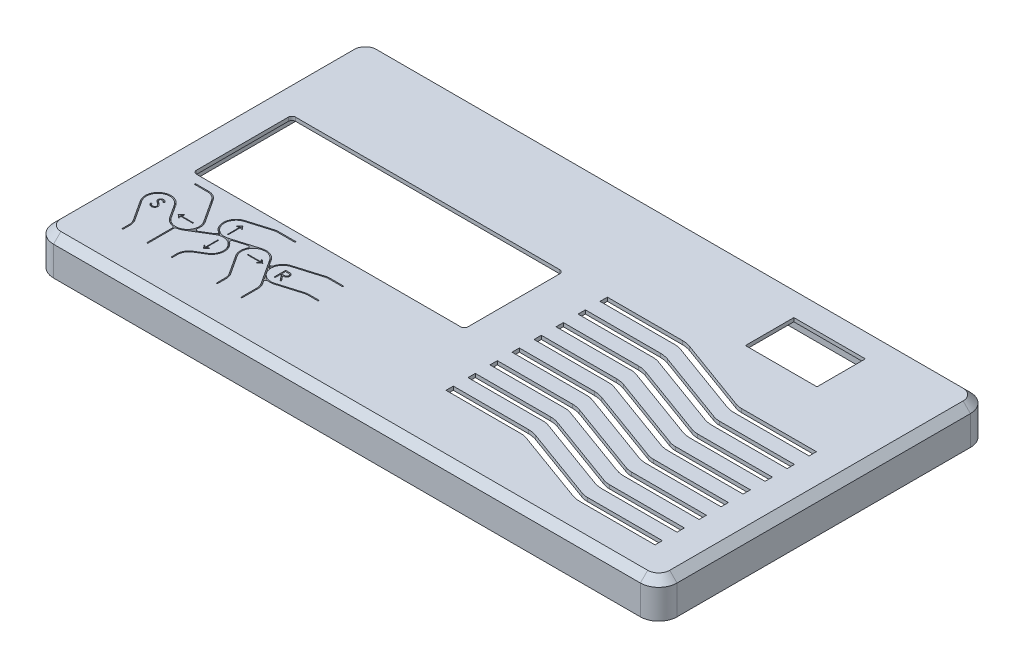
from build123d import *

# Parameters (mm, degrees)
CROQUIS1_W                        = 170
CROQUIS1_H                        = 90
SALIENTE_EXTRUIR1_DEPTH           = 8
REDONDEO1_R                       = 5
VACIADO1_T                        = -3
VACIADO1_THICKNESS_2_DEPTH        = 2
REDONDEO3_R                       = 2
CHAFL_N1_SIZE                     = 2
CROQUIS2_W                        = 74
CROQUIS2_H                        = 27
CORTAR_EXTRUIR3_DEPTH             = 177.036927944
REDONDEO2_R                       = 1
CROQUIS9_R                        = 1.5
SALIENTE_EXTRUIR2_DEPTH           = 3.5
REDONDEO7_R                       = 1
REDONDEO7_OF_MATRIZ_DE_CROQUIS3_R = 1
CORTAR_EXTRUIR_L_MINA3_DEPTH      = 177.036927944
CORTAR_EXTRUIR_L_MINA4_DEPTH      = 177.036927944
CORTAR_EXTRUIR_L_MINA5_DEPTH      = 177.036927944
CORTAR_EXTRUIR_L_MINA6_DEPTH      = 177.036927944
CORTAR_EXTRUIR_L_MINA7_DEPTH      = 177.036927944
CROQUIS7_7_W                      = 0.3
CROQUIS7_7_H                      = 7.65
CORTAR_EXTRUIR_L_MINA8_DEPTH      = 177.036927944
REDONDEO5_R                       = 0.5
REDONDEO6_R                       = 0.1
CORTAR_EXTRUIR4_DEPTH             = 0.5
LABIO1_START                      = -2
LABIO1_DEPTH                      = 2
CROQUIS11_W                       = 19.5
CROQUIS11_H                       = 13.2
CORTAR_EXTRUIR5_DEPTH             = 1
CORTAR_EXTRUIR_L_MINA9_DEPTH      = 177.139149544
MATRIZL1_COUNT                    = 8
MATRIZL1_PITCH                    = 6


with BuildPart() as part:
    # Croquis1 → Saliente-Extruir1 (new body)
    with BuildSketch(Plane(origin=(0, 0, 0), x_dir=(1, 0, 0), z_dir=(0, 1, 0))):
        with Locations((85, 0)):
            Rectangle(CROQUIS1_W, CROQUIS1_H)
    extrude(amount=SALIENTE_EXTRUIR1_DEPTH)

    # Redondeo1
    redondeo1_edges = [part.edges().sort_by_distance(p)[0] for p in [
        (0, 4, -45),
        (170, 4, -45),
        (170, 4, 45),
        (0, 4, 45),
    ]]
    fillet(redondeo1_edges, radius=REDONDEO1_R)

    # Vaciado1
    vaciado1_openings = [part.faces().sort_by_distance(p)[0] for p in [
        (85, 0, 0),
    ]]
    offset(amount=VACIADO1_T, openings=vaciado1_openings, kind=Kind.INTERSECTION)

    # Vaciado1 thickness 2 face (on inner face of the shell) → Vaciado1 thickness 2 (cut)
    with BuildSketch(Plane(origin=(85, 5, 0), x_dir=(0, 0, 1), z_dir=(0, 1, 0))):
        with BuildLine():
            Line((-40, 82), (40, 82))
            ThreePointArc((40, 82), (41.414213562, 81.414213562), (42, 80))
            Line((42, 80), (42, -80))
            ThreePointArc((42, -80), (41.414213562, -81.414213562), (40, -82))
            Line((40, -82), (-40, -82))
            ThreePointArc((-40, -82), (-41.414213562, -81.414213562), (-42, -80))
            Line((-42, -80), (-42, 80))
            ThreePointArc((-42, 80), (-41.414213562, 81.414213562), (-40, 82))
        make_face()
    extrude(amount=VACIADO1_THICKNESS_2_DEPTH, mode=Mode.SUBTRACT)

    # Redondeo3
    redondeo3_edges = [part.edges().sort_by_distance(p)[0] for p in [
        (85, 7, -42),
        (3.585786438, 7, -41.414213562),
        (3, 7, 0),
        (3.585786438, 7, 41.414213562),
        (85, 7, 42),
        (166.414213562, 7, 41.414213562),
        (167, 7, 0),
        (166.414213562, 7, -41.414213562),
    ]]
    fillet(redondeo3_edges, radius=REDONDEO3_R)

    # Chaflán1
    chafl_n1_edges = [part.edges().sort_by_distance(p)[0] for p in [
        (0, 8, 0),
        (85, 8, -45),
        (85, 8, 45),
        (170, 8, 0),
        (1.464466094, 8, 43.535533906),
        (168.535533906, 8, 43.535533906),
        (168.535533906, 8, -43.535533906),
        (1.464466094, 8, -43.535533906),
    ]]
    chamfer(chafl_n1_edges, length=CHAFL_N1_SIZE)

    # Croquis2 → Cortar-Extruir3 (cut, through all)
    with BuildSketch(Plane(origin=(0, 0, 0), x_dir=(1, 0, 0), z_dir=(0, 1, 0))):
        with Locations((46, 2.5)):
            Rectangle(CROQUIS2_W, CROQUIS2_H)
    extrude(amount=CORTAR_EXTRUIR3_DEPTH, mode=Mode.SUBTRACT)

    # Redondeo2
    redondeo2_edges = [part.edges().sort_by_distance(p)[0] for p in [
        (9, 7.5, -16),
        (9, 7.5, 11),
        (83, 7.5, 11),
        (83, 7.5, -16),
    ]]
    fillet(redondeo2_edges, radius=REDONDEO2_R)

    # Croquis9 → Saliente-Extruir2 (add)
    with BuildSketch(Plane.XZ.offset(-7)):
        with Locations(Location((11.5, 23, 0), (0, 0, 90))):
            Circle(CROQUIS9_R)
    saliente_extruir2 = extrude(amount=SALIENTE_EXTRUIR2_DEPTH)

    # Redondeo7
    redondeo7_edges = [part.edges().sort_by_distance(p)[0] for p in [
        (11.5, 7, 21.5),
    ]]
    fillet(redondeo7_edges, radius=REDONDEO7_R)

    # Matriz de croquis3: Saliente-Extruir2 at 5 more places
    with Locations((8, 0, 0), (17, 0, -4.3), (17, 0, 2.4), (26, 0, 0), (34, 0, 0)):
        add(saliente_extruir2)

    # Redondeo7 of Matriz de croquis3
    redondeo7_of_matriz_de_croquis3_edges = [part.edges().sort_by_distance(p)[0] for p in [
        (19.5, 7, 21.5),
        (28.5, 7, 17.2),
        (28.5, 7, 23.9),
        (37.5, 7, 21.5),
        (45.5, 7, 21.5),
    ]]
    fillet(redondeo7_of_matriz_de_croquis3_edges, radius=REDONDEO7_OF_MATRIZ_DE_CROQUIS3_R)

    # Croquis7 → Cortar-Extruir-Lámina3 (cut, through all)
    with BuildSketch(Plane(origin=(0, 8, 0), x_dir=(1, 0, 0), z_dir=(0, 1, 0))):
        with BuildLine():
            Line((38.671688717, -34), (38.671688717, -31.633266956))
            ThreePointArc((38.671688717, -31.633266956), (38.534786487, -30.692622231), (38.135438717, -29.830023784))
            Line((38.135438717, -29.830023784), (34.82, -24.74859944))
            ThreePointArc((34.82, -24.74859944), (35.75140056, -20.32), (40.18, -21.25140056))
            Line((40.18, -21.25140056), (44.584188717, -28.001503239))
            ThreePointArc((44.584188717, -28.001503239), (44.947232144, -28.785683645), (45.071688717, -29.640815214))
            Line((45.071688717, -29.640815214), (45.071688717, -34))
            Line((45.071688717, -34), (45.371688717, -34))
            Line((45.371688717, -34), (45.371688717, -29.640815214))
            ThreePointArc((45.371688717, -29.640815214), (45.234786487, -28.700170488), (44.835438717, -27.837572042))
            Line((44.835438717, -27.837572042), (40.43125, -21.087469363))
            ThreePointArc((40.43125, -21.087469363), (35.587469363, -20.06875), (34.56875, -24.912530637))
            Line((34.56875, -24.912530637), (37.884188717, -29.993954982))
            ThreePointArc((37.884188717, -29.993954982), (38.247232144, -30.778135388), (38.371688717, -31.633266956))
            Line((38.371688717, -31.633266956), (38.371688717, -34))
            Line((38.371688717, -34), (38.671688717, -34))
        make_face()
    extrude(amount=-CORTAR_EXTRUIR_L_MINA3_DEPTH, mode=Mode.SUBTRACT)

    # Croquis7<3> → Cortar-Extruir-Lámina4 (cut, through all)
    with BuildSketch(Plane(origin=(0, 8, 0), x_dir=(1, 0, 0), z_dir=(0, 1, 0))):
        with BuildLine():
            Line((56.5, -24.043300835), (53.657797163, -24.043300835))
            ThreePointArc((53.657797163, -24.043300835), (53.179651061, -24.078124529), (52.711596362, -24.181860649))
            Line((52.711596362, -24.181860649), (46.417528049, -26.065638968))
            ThreePointArc((46.417528049, -26.065638968), (42.434361032, -23.917528049), (44.582471951, -19.934361032))
            Line((44.582471951, -19.934361032), (51.816479579, -17.769264303))
            ThreePointArc((51.816479579, -17.769264303), (52.241983851, -17.674958739), (52.676662124, -17.643300835))
            Line((52.676662124, -17.643300835), (56.5, -17.643300835))
            Line((56.5, -17.643300835), (56.5, -17.343300835))
            Line((56.5, -17.343300835), (52.676662124, -17.343300835))
            ThreePointArc((52.676662124, -17.343300835), (52.198516023, -17.378124529), (51.730461324, -17.481860649))
            Line((51.730461324, -17.481860649), (44.496453697, -19.646957379))
            ThreePointArc((44.496453697, -19.646957379), (42.146957379, -24.003546303), (46.503546303, -26.353042621))
            Line((46.503546303, -26.353042621), (52.797614617, -24.469264303))
            ThreePointArc((52.797614617, -24.469264303), (53.223118889, -24.374958739), (53.657797163, -24.343300835))
            Line((53.657797163, -24.343300835), (56.5, -24.343300835))
            Line((56.5, -24.343300835), (56.5, -24.043300835))
        make_face()
    extrude(amount=-CORTAR_EXTRUIR_L_MINA4_DEPTH, mode=Mode.SUBTRACT)

    # Croquis7<4> → Cortar-Extruir-Lámina5 (cut, through all)
    with BuildSketch(Plane(origin=(0, 8, 0), x_dir=(1, 0, 0), z_dir=(0, 1, 0))):
        with BuildLine():
            Line((36.496453697, -19.646957379), (29.417528049, -21.765638968))
            ThreePointArc((29.417528049, -21.765638968), (25.434361032, -19.617528049), (27.582471951, -15.634361032))
            Line((27.582471951, -15.634361032), (33.791738249, -13.775963468))
            ThreePointArc((33.791738249, -13.775963468), (34.217242521, -13.681657904), (34.651920795, -13.65))
            Line((34.651920795, -13.65), (39.486575375, -13.65))
            Line((39.486575375, -13.65), (39.486575375, -13.35))
            Line((39.486575375, -13.35), (34.651920795, -13.35))
            ThreePointArc((34.651920795, -13.35), (34.173774694, -13.384823695), (33.705719995, -13.488559815))
            Line((33.705719995, -13.488559815), (27.496453697, -15.346957379))
            ThreePointArc((27.496453697, -15.346957379), (25.146957379, -19.703546303), (29.503546303, -22.053042621))
            Line((29.503546303, -22.053042621), (36.582471951, -19.934361032))
            Line((36.582471951, -19.934361032), (36.496453697, -19.646957379))
        make_face()
    extrude(amount=-CORTAR_EXTRUIR_L_MINA5_DEPTH, mode=Mode.SUBTRACT)

    # Croquis7<5> → Cortar-Extruir-Lámina6 (cut, through all)
    with BuildSketch(Plane(origin=(0, 8, 0), x_dir=(1, 0, 0), z_dir=(0, 1, 0))):
        with BuildLine():
            Line((26.35, -34), (26.35, -32.476308028))
            ThreePointArc((26.35, -32.476308028), (26.738082767, -31.000540984), (27.801925577, -29.906587112))
            Line((27.801925577, -29.906587112), (30.306086826, -28.398007734))
            ThreePointArc((30.306086826, -28.398007734), (31.498007734, -23.593913174), (26.693913174, -22.401992266))
            Line((26.693913174, -22.401992266), (21.151279384, -25.741035643))
            Line((21.151279384, -25.741035643), (21.306086826, -25.998007734))
            Line((21.306086826, -25.998007734), (26.848720616, -22.658964357))
            ThreePointArc((26.848720616, -22.658964357), (31.241035643, -23.748720616), (30.151279384, -28.141035643))
            Line((30.151279384, -28.141035643), (27.647118135, -29.649615021))
            ThreePointArc((27.647118135, -29.649615021), (26.476891043, -30.85296428), (26.05, -32.476308028))
            Line((26.05, -32.476308028), (26.05, -34))
            Line((26.05, -34), (26.35, -34))
        make_face()
    extrude(amount=-CORTAR_EXTRUIR_L_MINA6_DEPTH, mode=Mode.SUBTRACT)

    # Croquis7<6> → Cortar-Extruir-Lámina7 (cut, through all)
    with BuildSketch(Plane(origin=(0, 8, 0), x_dir=(1, 0, 0), z_dir=(0, 1, 0))):
        with BuildLine():
            Line((12.005671979, -13.65), (15.595669238, -13.65))
            ThreePointArc((15.595669238, -13.65), (17.024316164, -14.012014412), (18.108169238, -15.010688025))
            Line((18.108169238, -15.010688025), (22.18, -21.25140056))
            ThreePointArc((22.18, -21.25140056), (21.24859944, -25.68), (16.82, -24.74859944))
            Line((16.82, -24.74859944), (14.43125, -21.087469363))
            ThreePointArc((14.43125, -21.087469363), (9.587469363, -20.06875), (8.56875, -24.912530637))
            Line((8.56875, -24.912530637), (12.1625, -30.420510213))
            ThreePointArc((12.1625, -30.420510213), (12.525543427, -31.204690619), (12.65, -32.059822188))
            Line((12.65, -32.059822188), (12.65, -34))
            Line((12.65, -34), (12.95, -34))
            Line((12.95, -34), (12.95, -32.059822188))
            ThreePointArc((12.95, -32.059822188), (12.81309777, -31.119177462), (12.41375, -30.256579016))
            Line((12.41375, -30.256579016), (8.82, -24.74859944))
            ThreePointArc((8.82, -24.74859944), (9.75140056, -20.32), (14.18, -21.25140056))
            Line((14.18, -21.25140056), (16.56875, -24.912530637))
            ThreePointArc((16.56875, -24.912530637), (21.412530637, -25.93125), (22.43125, -21.087469363))
            Line((22.43125, -21.087469363), (18.359419238, -14.846756828))
            ThreePointArc((18.359419238, -14.846756828), (17.167180857, -13.748215853), (15.595669238, -13.35))
            Line((15.595669238, -13.35), (12.005671979, -13.35))
            Line((12.005671979, -13.35), (12.005671979, -13.65))
        make_face()
    extrude(amount=-CORTAR_EXTRUIR_L_MINA7_DEPTH, mode=Mode.SUBTRACT)

    # Croquis7<7> → Cortar-Extruir-Lámina8 (cut, through all)
    with BuildSketch(Plane(origin=(0, 8, 0), x_dir=(1, 0, 0), z_dir=(0, 1, 0))):
        with BuildLine():
            Line((36.496453697, -19.646957379), (29.417528049, -21.765638968))
            ThreePointArc((29.417528049, -21.765638968), (25.434361032, -19.617528049), (27.582471951, -15.634361032))
            Line((27.582471951, -15.634361032), (33.791738249, -13.775963468))
            ThreePointArc((33.791738249, -13.775963468), (34.217242521, -13.681657904), (34.651920795, -13.65))
            Line((34.651920795, -13.65), (39.486575375, -13.65))
            Line((39.486575375, -13.65), (39.486575375, -13.35))
            Line((39.486575375, -13.35), (34.651920795, -13.35))
            ThreePointArc((34.651920795, -13.35), (34.173774694, -13.384823695), (33.705719995, -13.488559815))
            Line((33.705719995, -13.488559815), (27.496453697, -15.346957379))
            ThreePointArc((27.496453697, -15.346957379), (25.146957379, -19.703546303), (29.503546303, -22.053042621))
            Line((29.503546303, -22.053042621), (36.582471951, -19.934361032))
            Line((36.582471951, -19.934361032), (36.496453697, -19.646957379))
        make_face()
        with BuildLine():
            Line((38.671688717, -34), (38.671688717, -31.633266956))
            ThreePointArc((38.671688717, -31.633266956), (38.534786487, -30.692622231), (38.135438717, -29.830023784))
            Line((38.135438717, -29.830023784), (34.82, -24.74859944))
            ThreePointArc((34.82, -24.74859944), (35.75140056, -20.32), (40.18, -21.25140056))
            Line((40.18, -21.25140056), (44.584188717, -28.001503239))
            ThreePointArc((44.584188717, -28.001503239), (44.947232144, -28.785683645), (45.071688717, -29.640815214))
            Line((45.071688717, -29.640815214), (45.071688717, -34))
            Line((45.071688717, -34), (45.371688717, -34))
            Line((45.371688717, -34), (45.371688717, -29.640815214))
            ThreePointArc((45.371688717, -29.640815214), (45.234786487, -28.700170488), (44.835438717, -27.837572042))
            Line((44.835438717, -27.837572042), (40.43125, -21.087469363))
            ThreePointArc((40.43125, -21.087469363), (35.587469363, -20.06875), (34.56875, -24.912530637))
            Line((34.56875, -24.912530637), (37.884188717, -29.993954982))
            ThreePointArc((37.884188717, -29.993954982), (38.247232144, -30.778135388), (38.371688717, -31.633266956))
            Line((38.371688717, -31.633266956), (38.371688717, -34))
            Line((38.371688717, -34), (38.671688717, -34))
        make_face()
        with BuildLine():
            Line((12.005671979, -13.65), (15.595669238, -13.65))
            ThreePointArc((15.595669238, -13.65), (17.024316164, -14.012014412), (18.108169238, -15.010688025))
            Line((18.108169238, -15.010688025), (22.18, -21.25140056))
            ThreePointArc((22.18, -21.25140056), (21.24859944, -25.68), (16.82, -24.74859944))
            Line((16.82, -24.74859944), (14.43125, -21.087469363))
            ThreePointArc((14.43125, -21.087469363), (9.587469363, -20.06875), (8.56875, -24.912530637))
            Line((8.56875, -24.912530637), (12.1625, -30.420510213))
            ThreePointArc((12.1625, -30.420510213), (12.525543427, -31.204690619), (12.65, -32.059822188))
            Line((12.65, -32.059822188), (12.65, -34))
            Line((12.65, -34), (12.95, -34))
            Line((12.95, -34), (12.95, -32.059822188))
            ThreePointArc((12.95, -32.059822188), (12.81309777, -31.119177462), (12.41375, -30.256579016))
            Line((12.41375, -30.256579016), (8.82, -24.74859944))
            ThreePointArc((8.82, -24.74859944), (9.75140056, -20.32), (14.18, -21.25140056))
            Line((14.18, -21.25140056), (16.56875, -24.912530637))
            ThreePointArc((16.56875, -24.912530637), (21.412530637, -25.93125), (22.43125, -21.087469363))
            Line((22.43125, -21.087469363), (18.359419238, -14.846756828))
            ThreePointArc((18.359419238, -14.846756828), (17.167180857, -13.748215853), (15.595669238, -13.35))
            Line((15.595669238, -13.35), (12.005671979, -13.35))
            Line((12.005671979, -13.35), (12.005671979, -13.65))
        make_face()
        with BuildLine():
            Line((26.35, -34), (26.35, -32.476308028))
            ThreePointArc((26.35, -32.476308028), (26.738082767, -31.000540984), (27.801925577, -29.906587112))
            Line((27.801925577, -29.906587112), (30.306086826, -28.398007734))
            ThreePointArc((30.306086826, -28.398007734), (31.498007734, -23.593913174), (26.693913174, -22.401992266))
            Line((26.693913174, -22.401992266), (21.151279384, -25.741035643))
            Line((21.151279384, -25.741035643), (21.306086826, -25.998007734))
            Line((21.306086826, -25.998007734), (26.848720616, -22.658964357))
            ThreePointArc((26.848720616, -22.658964357), (31.241035643, -23.748720616), (30.151279384, -28.141035643))
            Line((30.151279384, -28.141035643), (27.647118135, -29.649615021))
            ThreePointArc((27.647118135, -29.649615021), (26.476891043, -30.85296428), (26.05, -32.476308028))
            Line((26.05, -32.476308028), (26.05, -34))
            Line((26.05, -34), (26.35, -34))
        make_face()
        with Locations((19.5, -30.175)):
            Rectangle(CROQUIS7_7_W, CROQUIS7_7_H)
        with BuildLine():
            Line((56.5, -24.043300835), (53.657797163, -24.043300835))
            ThreePointArc((53.657797163, -24.043300835), (53.179651061, -24.078124529), (52.711596362, -24.181860649))
            Line((52.711596362, -24.181860649), (46.417528049, -26.065638968))
            ThreePointArc((46.417528049, -26.065638968), (42.434361032, -23.917528049), (44.582471951, -19.934361032))
            Line((44.582471951, -19.934361032), (51.816479579, -17.769264303))
            ThreePointArc((51.816479579, -17.769264303), (52.241983851, -17.674958739), (52.676662124, -17.643300835))
            Line((52.676662124, -17.643300835), (56.5, -17.643300835))
            Line((56.5, -17.643300835), (56.5, -17.343300835))
            Line((56.5, -17.343300835), (52.676662124, -17.343300835))
            ThreePointArc((52.676662124, -17.343300835), (52.198516023, -17.378124529), (51.730461324, -17.481860649))
            Line((51.730461324, -17.481860649), (44.496453697, -19.646957379))
            ThreePointArc((44.496453697, -19.646957379), (42.146957379, -24.003546303), (46.503546303, -26.353042621))
            Line((46.503546303, -26.353042621), (52.797614617, -24.469264303))
            ThreePointArc((52.797614617, -24.469264303), (53.223118889, -24.374958739), (53.657797163, -24.343300835))
            Line((53.657797163, -24.343300835), (56.5, -24.343300835))
            Line((56.5, -24.343300835), (56.5, -24.043300835))
        make_face()
    extrude(amount=-CORTAR_EXTRUIR_L_MINA8_DEPTH, mode=Mode.SUBTRACT)

    # Redondeo5
    redondeo5_edges = [part.edges().sort_by_distance(p)[0] for p in [
        (19.35, 7.5, 26.496784237),
        (19.65, 7.5, 26.496784237),
        (35.224255276, 7.5, 20.340867444),
        (42.045291385, 7.5, 23.561238263),
        (43.594708615, 7.5, 25.935960616),
        (27.486343253, 7.5, 22.05),
        (29.513684366, 7.5, 22.050008357),
        (22.36568211, 7.5, 25.009444213),
    ]]
    fillet(redondeo5_edges, radius=REDONDEO5_R)

    # Redondeo6
    redondeo6_edges = [part.edges().sort_by_distance(p)[0] for p in [
        (38.371688717, 7.5, 34),
        (45.371688717, 7.5, 34),
        (45.071688717, 7.5, 34),
        (38.671688717, 7.5, 34),
        (56.5, 7.5, 24.343300835),
        (56.5, 7.5, 17.343300835),
        (56.5, 7.5, 17.643300835),
        (56.5, 7.5, 24.043300835),
        (39.486575375, 7.5, 13.35),
        (39.486575375, 7.5, 13.65),
        (26.05, 7.5, 34),
        (26.35, 7.5, 34),
        (12.005671979, 7.5, 13.35),
        (12.95, 7.5, 34),
        (12.65, 7.5, 34),
        (12.005671979, 7.5, 13.65),
        (19.65, 7.5, 34),
        (19.35, 7.5, 34),
    ]]
    fillet(redondeo6_edges, radius=REDONDEO6_R)

    # Croquis8 → Cortar-Extruir4 (cut)
    # profile 1 of 6: a face of its own
    with BuildSketch(Plane(origin=(0, 8, 0), x_dir=(1, 0, 0), z_dir=(0, 1, 0))):
        with BuildLine():
            Line((10.481410256, -24.087515024), (10.749809696, -23.926602564))
            add(Edge.make_bspline(
                [(10.749809696, -23.926602564), (10.774772668, -23.968389542), (10.82260076, -24.048451779), (10.902385207, -24.156635858), (10.985055776, -24.248585815), (11.071224672, -24.323766737), (11.160365925, -24.382956799), (11.253061459, -24.424868823), (11.348998902, -24.45100903), (11.41428944, -24.454184108), (11.446885016, -24.455769231)],
                knots=[0, 0, 0, 0, 1.272034388, 2.437168799, 3.508375237, 4.49857839, 5.41946034, 6.295179144, 7.148887113, 8, 8, 8, 8], degree=3))
            add(Edge.make_bspline(
                [(11.446885016, -24.455769231), (11.474722382, -24.454993921), (11.529910026, -24.453456867), (11.611155775, -24.438687853), (11.690060696, -24.415998279), (11.764998532, -24.383503577), (11.834935268, -24.344189379), (11.896264199, -24.296703918), (11.949283173, -24.243539717), (11.992652869, -24.184228309), (12.025926901, -24.12044061), (12.051501135, -24.054966712), (12.065693452, -23.986778082), (12.067831364, -23.940867162), (12.068910256, -23.917698317)],
                knots=[0, 0, 0, 0, 1.095163259, 2.171163733, 3.241058638, 4.321873601, 5.38011039, 6.391990106, 7.366004449, 8.327778327, 9.272591725, 10.192022065, 11.087607919, 12, 12, 12, 12], degree=3))
            add(Edge.make_bspline(
                [(12.068910256, -23.917698317), (12.067572846, -23.891263404), (12.064854086, -23.837525087), (12.041874815, -23.758241116), (12.005725855, -23.679779999), (11.972376886, -23.631246708), (11.955063101, -23.606049679)],
                knots=[0, 0, 0, 0, 0.938893495, 1.908633276, 2.914225137, 4, 4, 4, 4], degree=3))
            add(Edge.make_bspline(
                [(11.955063101, -23.606049679), (11.940847615, -23.587864347), (11.911003981, -23.549686515), (11.859698238, -23.492858337), (11.799494691, -23.4342402), (11.732453609, -23.37159377), (11.656132878, -23.307832697), (11.572922919, -23.239916473), (11.480699275, -23.1704279), (11.416020446, -23.123825644), (11.382647236, -23.099779647)],
                knots=[0, 0, 0, 0, 0.722233717, 1.516239348, 2.393582979, 3.351407094, 4.387010283, 5.505090956, 6.712668013, 8, 8, 8, 8], degree=3))
            add(Edge.make_bspline(
                [(11.382647236, -23.099779647), (11.34924261, -23.075986572), (11.285375511, -23.030496022), (11.196059511, -22.962982565), (11.116190606, -22.901257054), (11.046123783, -22.844738415), (10.985889863, -22.79341898), (10.935014198, -22.747791564), (10.894792792, -22.706622191), (10.872426658, -22.679914688), (10.862384816, -22.667923678)],
                knots=[0, 0, 0, 0, 1.452282411, 2.77665338, 3.964542531, 5.026858415, 5.96415736, 6.766646006, 7.446254459, 8, 8, 8, 8], degree=3))
            add(Edge.make_bspline(
                [(10.862384816, -22.667923678), (10.848349007, -22.649235594), (10.820745705, -22.61248297), (10.7843094, -22.555038278), (10.753340302, -22.496234316), (10.729063044, -22.435913067), (10.708619474, -22.374921382), (10.694869065, -22.312463466), (10.686259012, -22.248819576), (10.685377282, -22.205990186), (10.684935897, -22.18455028)],
                knots=[0, 0, 0, 0, 1.068054152, 2.10047183, 3.106115577, 4.101338837, 5.06977816, 6.043150881, 7.020423561, 8, 8, 8, 8], degree=3))
            add(Edge.make_bspline(
                [(10.684935897, -22.18455028), (10.686119908, -22.150958985), (10.688462623, -22.084494384), (10.708275092, -21.987402131), (10.739546932, -21.894704452), (10.783357294, -21.807319078), (10.839833607, -21.727521367), (10.905189598, -21.654393418), (10.983032875, -21.592917633), (11.068442755, -21.539203837), (11.161929606, -21.497161462), (11.259892783, -21.465446859), (11.362487984, -21.447477032), (11.431977971, -21.444898238), (11.46723758, -21.443589744)],
                knots=[0, 0, 0, 0, 1.005424448, 1.989358655, 2.955360095, 3.929531133, 4.905563448, 5.876582895, 6.856512386, 7.866279853, 8.892233794, 9.918561126, 10.94386622, 12, 12, 12, 12], degree=3))
            add(Edge.make_bspline(
                [(11.46723758, -21.443589744), (11.504651871, -21.444880201), (11.579056954, -21.447446509), (11.688503029, -21.469759984), (11.793877393, -21.506681308), (11.878643783, -21.548581019), (11.944985645, -21.590428803), (11.995579481, -21.628546787), (12.046848883, -21.672429921), (12.099207404, -21.722195094), (12.15176786, -21.778298933), (12.205310563, -21.8403572), (12.259960721, -21.907990648), (12.295117822, -21.956272873), (12.313141026, -21.981024639)],
                knots=[0, 0, 0, 0, 1.286793592, 2.559021753, 3.825965368, 5.121522368, 5.803751409, 6.523245864, 7.299691795, 8.125521123, 9.008227632, 9.944561021, 10.946284179, 12, 12, 12, 12], degree=3))
            Line((12.313141026, -21.981024639), (12.055553886, -22.176282051))
            add(Edge.make_bspline(
                [(12.055553886, -22.176282051), (12.040000076, -22.156244454), (12.010047074, -22.117656725), (11.964572468, -22.063617032), (11.921711195, -22.014253511), (11.879483332, -21.971377288), (11.840119109, -21.932640353), (11.801912935, -21.89947543), (11.765414631, -21.871557569), (11.719407148, -21.841763768), (11.661606075, -21.812230368), (11.589048674, -21.787239419), (11.513223982, -21.772221613), (11.461580673, -21.770235979), (11.435436699, -21.769230769)],
                knots=[0, 0, 0, 0, 1.181633172, 2.275549214, 3.290209073, 4.226197932, 5.078386478, 5.862611352, 6.581680152, 7.217281963, 8.414376989, 9.595101626, 10.782541182, 12, 12, 12, 12], degree=3))
            add(Edge.make_bspline(
                [(11.435436699, -21.769230769), (11.402637568, -21.770329954), (11.339387533, -21.772449629), (11.249589248, -21.795599901), (11.16876833, -21.832050589), (11.099324217, -21.883136319), (11.041505674, -21.943661791), (10.999681436, -22.013311181), (10.974508073, -22.090220932), (10.971436233, -22.143870863), (10.969871795, -22.17119391)],
                knots=[0, 0, 0, 0, 1.14458467, 2.207223713, 3.21896685, 4.227309161, 5.202851033, 6.127160689, 7.046193047, 8, 8, 8, 8], degree=3))
            add(Edge.make_bspline(
                [(10.969871795, -22.17119391), (10.970228417, -22.18820418), (10.970942244, -22.222252535), (10.980897953, -22.272554896), (10.993688059, -22.322730183), (11.013956018, -22.372552811), (11.041937115, -22.422894123), (11.078681096, -22.474620985), (11.124957457, -22.52818932), (11.16040589, -22.563030295), (11.179121595, -22.58142528)],
                knots=[0, 0, 0, 0, 0.858281714, 1.717966888, 2.583508476, 3.4729293, 4.427298488, 5.488583878, 6.674047936, 8, 8, 8, 8], degree=3))
            add(Edge.make_bspline(
                [(11.179121595, -22.58142528), (11.186071554, -22.58762744), (11.202583066, -22.60236235), (11.232769084, -22.626485347), (11.27263148, -22.656242148), (11.321129334, -22.693060642), (11.379156869, -22.735770254), (11.446720467, -22.783824888), (11.523067, -22.838784555), (11.577243309, -22.877208895), (11.605889423, -22.897526042)],
                knots=[0, 0, 0, 0, 0.420754252, 0.999615792, 1.744751191, 2.668019286, 3.750313428, 4.999500688, 6.413464383, 8, 8, 8, 8], degree=3))
            add(Edge.make_bspline(
                [(11.605889423, -22.897526042), (11.640348073, -22.922600704), (11.707072473, -22.971154311), (11.802011849, -23.044102821), (11.888094089, -23.115447582), (11.965621424, -23.184732983), (12.035359762, -23.251433467), (12.096535409, -23.316351495), (12.149771704, -23.379021979), (12.207084281, -23.459369958), (12.265647446, -23.558049942), (12.315940813, -23.678952344), (12.347653029, -23.800324721), (12.351800046, -23.881901208), (12.353846154, -23.922150441)],
                knots=[0, 0, 0, 0, 1.163667725, 2.253281268, 3.268753668, 4.215851969, 5.092017293, 5.902905408, 6.650798638, 7.335211899, 8.59617414, 9.77448103, 10.901945474, 12, 12, 12, 12], degree=3))
            add(Edge.make_bspline(
                [(12.353846154, -23.922150441), (12.353250036, -23.9506151), (12.352069376, -24.006991656), (12.33849769, -24.089773047), (12.318613422, -24.170173907), (12.288643931, -24.247200416), (12.252065066, -24.322261737), (12.20564997, -24.393388903), (12.151849427, -24.462156136), (12.090133083, -24.526729732), (12.022600015, -24.586008067), (11.951222663, -24.63873943), (11.875884201, -24.682707123), (11.796993328, -24.718585387), (11.714531923, -24.746646507), (11.628527719, -24.766978181), (11.538838948, -24.779456576), (11.477878511, -24.780751759), (11.446885016, -24.781410256)],
                knots=[0, 0, 0, 0, 0.983748083, 1.948392443, 2.894712957, 3.844097841, 4.80183111, 5.778335162, 6.776009319, 7.81870978, 8.863265674, 9.881300176, 10.883814829, 11.87499822, 12.874611388, 13.892143829, 14.928324115, 16, 16, 16, 16], degree=3))
            add(Edge.make_bspline(
                [(11.446885016, -24.781410256), (11.422904383, -24.780946542), (11.37524513, -24.780024952), (11.304751528, -24.771877648), (11.235682044, -24.76035049), (11.168903374, -24.742049726), (11.10355515, -24.719845611), (11.039921588, -24.692505838), (10.977971846, -24.659742377), (10.917358753, -24.62228189), (10.858236466, -24.57868665), (10.80115952, -24.527910693), (10.744255187, -24.471354413), (10.689203049, -24.407481974), (10.634889554, -24.337325284), (10.582385568, -24.260227954), (10.530604296, -24.176609926), (10.49811455, -24.117768026), (10.481410256, -24.087515024)],
                knots=[0, 0, 0, 0, 0.915332311, 1.819136955, 2.706846663, 3.586547465, 4.459518054, 5.340707479, 6.227863349, 7.133153174, 8.059268498, 9.028702269, 10.047606654, 11.120612155, 12.245963614, 13.433783089, 14.680604001, 16, 16, 16, 16], degree=3))
        make_face()
    # profile 2 of 6: a face of its own
    with BuildSketch(Plane(origin=(0, 8, 0), x_dir=(1, 0, 0), z_dir=(0, 1, 0))):
        with BuildLine():
            Line((44.807051282, -21.525), (45.442432893, -21.525))
            add(Edge.make_bspline(
                [(45.442432893, -21.525), (45.484833773, -21.525141139), (45.566248162, -21.525412141), (45.682882485, -21.526923226), (45.788861352, -21.531254248), (45.884129349, -21.53498132), (45.968684729, -21.541777582), (46.042786771, -21.548273311), (46.106094183, -21.556776561), (46.144417205, -21.564673623), (46.16176883, -21.568249199)],
                knots=[0, 0, 0, 0, 1.410062039, 2.707475311, 3.878576406, 4.937260626, 5.877586885, 6.699081471, 7.410979367, 8, 8, 8, 8], degree=3))
            add(Edge.make_bspline(
                [(46.16176883, -21.568249199), (46.184997696, -21.573988479), (46.230959894, -21.585344604), (46.297136025, -21.609347242), (46.360195448, -21.637123616), (46.419876217, -21.669747848), (46.475879399, -21.707462112), (46.528782438, -21.749615338), (46.578825394, -21.795976874), (46.623984444, -21.847715623), (46.66656487, -21.901995886), (46.702477409, -21.960691437), (46.733435002, -22.022070108), (46.758082542, -22.086756123), (46.77792899, -22.154122159), (46.791922792, -22.224778424), (46.800314941, -22.298403023), (46.801169339, -22.348620555), (46.801602564, -22.374083534)],
                knots=[0, 0, 0, 0, 1.027469482, 2.033020251, 3.019912614, 3.986113645, 4.951240523, 5.91722682, 6.890402269, 7.87763091, 8.8651537, 9.85103654, 10.82876324, 11.815024772, 12.821070561, 13.842952187, 14.906261191, 16, 16, 16, 16], degree=3))
            add(Edge.make_bspline(
                [(46.801602564, -22.374083534), (46.800269973, -22.416388236), (46.797669742, -22.498935667), (46.773426256, -22.618733752), (46.733714698, -22.730484059), (46.678992858, -22.83404588), (46.609306619, -22.927400537), (46.525554844, -23.009397593), (46.427690811, -23.078013799), (46.336587074, -23.125595987), (46.256110622, -23.156069554), (46.189858974, -23.177511108), (46.117589644, -23.194077319), (46.039995062, -23.208918296), (45.956752317, -23.220123047), (45.868060925, -23.228329601), (45.77385763, -23.233458631), (45.709142903, -23.234222449), (45.675851362, -23.234615385)],
                knots=[0, 0, 0, 0, 1.260483769, 2.459530307, 3.627416485, 4.787058657, 5.939039949, 7.08810263, 8.267026773, 9.491475466, 10.141966685, 10.831826277, 11.566392101, 12.351337768, 13.187381173, 14.07005841, 15.007169909, 16, 16, 16, 16], degree=3))
            Line((45.675851362, -23.234615385), (46.842307692, -24.7))
            Line((46.842307692, -24.7), (46.489953926, -24.7))
            Line((46.489953926, -24.7), (45.323497596, -23.234615385))
            Line((45.323497596, -23.234615385), (45.091987179, -23.234615385))
            Line((45.091987179, -23.234615385), (45.091987179, -24.7))
            Line((45.091987179, -24.7), (44.807051282, -24.7))
            Line((44.807051282, -24.7), (44.807051282, -21.525))
        make_face()
        with BuildLine():
            Line((45.091987179, -21.850641026), (45.091987179, -22.908974359))
            Line((45.091987179, -22.908974359), (45.673307292, -22.913426482))
            add(Edge.make_bspline(
                [(45.673307292, -22.913426482), (45.700449041, -22.91343849), (45.753057482, -22.913461764), (45.829167371, -22.909838838), (45.900033472, -22.9057174), (45.965384726, -22.89941335), (46.025250327, -22.891288914), (46.079600352, -22.881126207), (46.12852352, -22.869286121), (46.18558148, -22.850960361), (46.249296048, -22.82192633), (46.318539586, -22.779684771), (46.377505993, -22.726554212), (46.427324339, -22.66579972), (46.467356038, -22.599001123), (46.495579116, -22.526959131), (46.513488331, -22.451492467), (46.515600654, -22.399623755), (46.516666667, -22.373447516)],
                knots=[0, 0, 0, 0, 1.146690395, 2.22261258, 3.21895312, 4.145990853, 4.996080663, 5.770904154, 6.481378293, 7.121626537, 8.300444488, 9.431385265, 10.535395872, 11.636531494, 12.74115979, 13.810798291, 14.895190096, 16, 16, 16, 16], degree=3))
            add(Edge.make_bspline(
                [(46.516666667, -22.373447516), (46.515576171, -22.347914553), (46.513415207, -22.297317536), (46.495772395, -22.22324396), (46.465937028, -22.153333227), (46.425730426, -22.08786973), (46.376745479, -22.02844667), (46.319307177, -21.977603895), (46.254986036, -21.935649024), (46.194868592, -21.908838978), (46.141134699, -21.892401683), (46.09448065, -21.880834556), (46.041765238, -21.871541359), (45.982732501, -21.864095475), (45.91763445, -21.857695633), (45.846141931, -21.853385091), (45.76872928, -21.850832514), (45.715074564, -21.850706341), (45.687299679, -21.850641026)],
                knots=[0, 0, 0, 0, 1.101028733, 2.181837193, 3.264309656, 4.369019818, 5.486613113, 6.575447106, 7.666700264, 8.788928104, 9.402425223, 10.0903467, 10.862060571, 11.710948788, 12.657782767, 13.684531032, 14.801375019, 16, 16, 16, 16], degree=3))
            Line((45.687299679, -21.850641026), (45.091987179, -21.850641026))
        make_face(mode=Mode.SUBTRACT)
    # profile 3 of 6: a face of its own
    with BuildSketch(Plane(origin=(0, 8, 0), x_dir=(1, 0, 0), z_dir=(0, 1, 0))):
        with BuildLine():
            Line((17.858333333, -22.227564103), (18.021153846, -22.227564103))
            add(Edge.make_bspline(
                [(18.021153846, -22.227564103), (17.992183385, -22.286244127), (17.93472906, -22.402618565), (17.836550076, -22.569505165), (17.730955131, -22.729039223), (17.652921149, -22.829080084), (17.614102564, -22.878846154)],
                knots=[0, 0, 0, 0, 1.019914214, 2.022697593, 3.01637621, 4, 4, 4, 4], degree=3))
            Line((17.614102564, -22.878846154), (21.033333333, -22.878846154))
            Line((21.033333333, -22.878846154), (21.033333333, -23.082371795))
            Line((21.033333333, -23.082371795), (17.614102564, -23.082371795))
            add(Edge.make_bspline(
                [(17.614102564, -23.082371795), (17.631722213, -23.101246449), (17.668168766, -23.140289001), (17.719835214, -23.204718086), (17.771839049, -23.275532562), (17.822085419, -23.354005662), (17.873487271, -23.438660229), (17.923200908, -23.530843804), (17.973026109, -23.629689438), (18.004817558, -23.698364581), (18.021153846, -23.733653846)],
                knots=[0, 0, 0, 0, 0.802826809, 1.660661296, 2.566734236, 3.5342345, 4.557641891, 5.64644632, 6.790607818, 8, 8, 8, 8], degree=3))
            Line((18.021153846, -23.733653846), (17.85388121, -23.733653846))
            add(Edge.make_bspline(
                [(17.85388121, -23.733653846), (17.814577701, -23.690924583), (17.738022744, -23.607696981), (17.620543991, -23.491604709), (17.50660585, -23.384802998), (17.393780304, -23.290102823), (17.283742663, -23.205564809), (17.175461784, -23.132266817), (17.069495222, -23.069223753), (16.997638169, -23.034809241), (16.962820513, -23.018134014)],
                knots=[0, 0, 0, 0, 1.211045313, 2.358861152, 3.44488303, 4.468218803, 5.430702283, 6.338500846, 7.194936286, 8, 8, 8, 8], degree=3))
            Line((16.962820513, -23.018134014), (16.962820513, -22.927183494))
            add(Edge.make_bspline(
                [(16.962820513, -22.927183494), (16.995735903, -22.913109421), (17.064268574, -22.883805992), (17.166165764, -22.826625861), (17.272422242, -22.75787005), (17.38220242, -22.675945972), (17.496280001, -22.582256874), (17.613831648, -22.475471268), (17.735892806, -22.356747521), (17.81665878, -22.271533704), (17.858333333, -22.227564103)],
                knots=[0, 0, 0, 0, 0.749991578, 1.561546877, 2.44543843, 3.401885027, 4.431308655, 5.538962394, 6.730125603, 8, 8, 8, 8], degree=3))
        make_face()
    # profile 4 of 6: a face of its own
    with BuildSketch(Plane(origin=(0, 8, 0), x_dir=(1, 0, 0), z_dir=(0, 1, 0))):
        with BuildLine():
            add(Edge.make_bspline(
                [(27.725641026, -17.758673878), (27.769645946, -17.71724759), (27.855028432, -17.63686841), (27.973343477, -17.51482813), (28.080473674, -17.397639677), (28.174525483, -17.284260337), (28.256084383, -17.174396826), (28.324511748, -17.068523418), (28.382040439, -16.967028176), (28.411213806, -16.898635395), (28.425260417, -16.865705128)],
                knots=[0, 0, 0, 0, 1.268964064, 2.462163404, 3.568409878, 4.60242431, 5.55427946, 6.439681904, 7.248726414, 8, 8, 8, 8], degree=3))
            Line((28.425260417, -16.865705128), (28.51811899, -16.865705128))
            add(Edge.make_bspline(
                [(28.51811899, -16.865705128), (28.534497602, -16.900779256), (28.56825647, -16.97307249), (28.631930529, -17.078854768), (28.704145408, -17.188107388), (28.788649936, -17.298500869), (28.883547169, -17.411172417), (28.989645735, -17.525566278), (29.105811267, -17.642780751), (29.189014182, -17.719358611), (29.231730769, -17.758673878)],
                knots=[0, 0, 0, 0, 0.80670127, 1.662736828, 2.571316971, 3.536869484, 4.559727447, 5.642240233, 6.78952014, 8, 8, 8, 8], degree=3))
            Line((29.231730769, -17.758673878), (29.231730769, -17.924038462))
            add(Edge.make_bspline(
                [(29.231730769, -17.924038462), (29.196409933, -17.907764441), (29.127586345, -17.87605408), (29.029092998, -17.82532199), (28.936712833, -17.775781694), (28.852098001, -17.72431106), (28.773573412, -17.674133283), (28.70302069, -17.622015803), (28.638169402, -17.57108533), (28.599290999, -17.534646924), (28.580448718, -17.516987179)],
                knots=[0, 0, 0, 0, 1.209567812, 2.356875072, 3.445837619, 4.469393631, 5.437034397, 6.343238918, 7.197056603, 8, 8, 8, 8], degree=3))
            Line((28.580448718, -17.516987179), (28.580448718, -20.936217949))
            Line((28.580448718, -20.936217949), (28.376923077, -20.936217949))
            Line((28.376923077, -20.936217949), (28.376923077, -17.516987179))
            add(Edge.make_bspline(
                [(28.376923077, -17.516987179), (28.327131287, -17.555766272), (28.227177761, -17.633612579), (28.068041407, -17.739829013), (27.900783473, -17.83740558), (27.784295496, -17.895025473), (27.725641026, -17.924038462)],
                knots=[0, 0, 0, 0, 0.983597024, 1.974502037, 2.98011354, 4, 4, 4, 4], degree=3))
            Line((27.725641026, -17.924038462), (27.725641026, -17.758673878))
        make_face()
    # profile 5 of 6: a face of its own
    with BuildSketch(Plane(origin=(0, 8, 0), x_dir=(1, 0, 0), z_dir=(0, 1, 0))):
        with BuildLine():
            Line((27.725641026, -26.741341146), (27.725641026, -26.577884615))
            add(Edge.make_bspline(
                [(27.725641026, -26.577884615), (27.784295496, -26.606897604), (27.900783473, -26.664517497), (28.068041407, -26.762094064), (28.227177761, -26.868310498), (28.327131287, -26.946156805), (28.376923077, -26.984935897)],
                knots=[0, 0, 0, 0, 1.01988646, 2.025497963, 3.016402976, 4, 4, 4, 4], degree=3))
            Line((28.376923077, -26.984935897), (28.376923077, -23.565705128))
            Line((28.376923077, -23.565705128), (28.580448718, -23.565705128))
            Line((28.580448718, -23.565705128), (28.580448718, -26.984935897))
            add(Edge.make_bspline(
                [(28.580448718, -26.984935897), (28.599325588, -26.967319695), (28.638372725, -26.930880273), (28.70276492, -26.879156455), (28.773826413, -26.82732244), (28.851681937, -26.776101442), (28.936975575, -26.725733348), (29.028879499, -26.675769981), (29.127777582, -26.626030742), (29.196445312, -26.594227145), (29.231730769, -26.577884615)],
                knots=[0, 0, 0, 0, 0.802803951, 1.660614015, 2.566661157, 3.537744655, 4.557739901, 5.646513329, 6.790642251, 8, 8, 8, 8], degree=3))
            Line((29.231730769, -26.577884615), (29.231730769, -26.743249199))
            add(Edge.make_bspline(
                [(29.231730769, -26.743249199), (29.189025716, -26.782575007), (29.105845269, -26.859173398), (28.989410934, -26.976353507), (28.883767132, -27.091374635), (28.788590019, -27.204011434), (28.704371776, -27.314392897), (28.631735938, -27.423149825), (28.568280067, -27.52886646), (28.534505311, -27.601149006), (28.51811899, -27.636217949)],
                knots=[0, 0, 0, 0, 1.210543577, 2.357883875, 3.443707871, 4.466619676, 5.432223013, 6.337175649, 7.193256267, 8, 8, 8, 8], degree=3))
            Line((28.51811899, -27.636217949), (28.425260417, -27.636217949))
            add(Edge.make_bspline(
                [(28.425260417, -27.636217949), (28.411151855, -27.603532435), (28.381693655, -27.535286186), (28.324947058, -27.433562053), (28.255624759, -27.32805159), (28.174827677, -27.217652306), (28.08020648, -27.104304666), (27.973630941, -26.986408391), (27.854623745, -26.86440972), (27.769576298, -26.783261888), (27.725641026, -26.741341146)],
                knots=[0, 0, 0, 0, 0.746358587, 1.558371544, 2.439030802, 3.39337854, 4.426210597, 5.534488972, 6.726323911, 8, 8, 8, 8], degree=3))
        make_face()
    # profile 6 of 6: a face of its own
    with BuildSketch(Plane(origin=(0, 8, 0), x_dir=(1, 0, 0), z_dir=(0, 1, 0))):
        with BuildLine():
            add(Edge.make_bspline(
                [(39.137820513, -22.227564103), (39.179747236, -22.271493346), (39.260906645, -22.356529121), (39.382937389, -22.475727773), (39.501132559, -22.582033872), (39.615176236, -22.676008725), (39.724943025, -22.757637699), (39.830705423, -22.826832686), (39.932395447, -22.883624925), (40.000645837, -22.913077585), (40.033333333, -22.927183494)],
                knots=[0, 0, 0, 0, 1.273180312, 2.464551331, 3.575701909, 4.605305129, 5.561918586, 6.442235049, 7.253931932, 8, 8, 8, 8], degree=3))
            Line((40.033333333, -22.927183494), (40.033333333, -23.018134014))
            add(Edge.make_bspline(
                [(40.033333333, -23.018134014), (39.998292455, -23.03478567), (39.926157327, -23.069064755), (39.820044592, -23.132259069), (39.711719744, -23.20576694), (39.601116807, -23.28985082), (39.488284296, -23.385046977), (39.373692076, -23.49136338), (39.256255795, -23.607732846), (39.179679201, -23.69093675), (39.140364583, -23.733653846)],
                knots=[0, 0, 0, 0, 0.807943378, 1.663231663, 2.569814274, 3.534523911, 4.556488974, 5.644298431, 6.790576824, 8, 8, 8, 8], degree=3))
            Line((39.140364583, -23.733653846), (38.975, -23.733653846))
            add(Edge.make_bspline(
                [(38.975, -23.733653846), (38.991336288, -23.698364581), (39.023127737, -23.629689438), (39.072952938, -23.530843804), (39.122666576, -23.438660229), (39.174068427, -23.354005662), (39.224314797, -23.275532562), (39.276318633, -23.204718086), (39.32798508, -23.140289001), (39.364431633, -23.101246449), (39.382051282, -23.082371795)],
                knots=[0, 0, 0, 0, 1.209392182, 2.35355368, 3.442358109, 4.4657655, 5.433265764, 6.339338704, 7.197173191, 8, 8, 8, 8], degree=3))
            Line((39.382051282, -23.082371795), (35.962820513, -23.082371795))
            Line((35.962820513, -23.082371795), (35.962820513, -22.878846154))
            Line((35.962820513, -22.878846154), (39.382051282, -22.878846154))
            add(Edge.make_bspline(
                [(39.382051282, -22.878846154), (39.343232697, -22.829080084), (39.265198716, -22.729039223), (39.15960377, -22.569505165), (39.061424786, -22.402618565), (39.003970461, -22.286244127), (38.975, -22.227564103)],
                knots=[0, 0, 0, 0, 0.98362379, 1.977302407, 2.980085786, 4, 4, 4, 4], degree=3))
            Line((38.975, -22.227564103), (39.137820513, -22.227564103))
        make_face()
    extrude(amount=-CORTAR_EXTRUIR4_DEPTH, mode=Mode.SUBTRACT)

    # Labio1: read off the stored shape, not the designer's step
    # Labio1 outline → Labio1 (add)
    with BuildSketch(Plane(origin=(0, 0, 0), x_dir=(1, 0, 0), z_dir=(0, 1, 0)).offset(LABIO1_START)):
        with BuildLine():
            Line((0, 40), (0, -40))
            ThreePointArc((0, -40), (1.464466094, -43.535533906), (5, -45))
            Line((5, -45), (165, -45))
            ThreePointArc((165, -45), (168.535533906, -43.535533906), (170, -40))
            Line((170, -40), (170, 40))
            ThreePointArc((170, 40), (168.535533906, 43.535533906), (165, 45))
            Line((165, 45), (5, 45))
            ThreePointArc((5, 45), (1.464466094, 43.535533906), (0, 40))
        make_face()
    extrude(amount=LABIO1_DEPTH)

    # Labio1 2: loft between two sections, ruled curve by curve
    labio1_2_from = [
        Edge.make_three_point_arc((165, 0, -44), (167.828427125, 0, -42.828427125), (169, 0, -40)),
        Edge.make_three_point_arc((1, 0, -40), (2.171572875, 0, -42.828427125), (5, 0, -44)),
        Edge.make_three_point_arc((5, 0, 44), (2.171572875, 0, 42.828427125), (1, 0, 40)),
        Edge.make_three_point_arc((169, 0, 40), (167.828427125, 0, 42.828427125), (165, 0, 44)),
        Edge.make_line((165, 0, -44), (5, 0, -44)),
        Edge.make_line((1, 0, -40), (1, 0, 40)),
        Edge.make_line((5, 0, 44), (165, 0, 44)),
        Edge.make_line((169, 0, 40), (169, 0, -40)),
    ]
    labio1_2_to = [
        Edge.make_three_point_arc((165, -2, -44.104815559), (167.902542917, -2, -42.902542917), (169.104815559, -2, -40)),
        Edge.make_three_point_arc((0.895184441, -2, -40), (2.097457083, -2, -42.902542917), (5, -2, -44.104815559)),
        Edge.make_three_point_arc((5, -2, 44.104815559), (2.097457083, -2, 42.902542917), (0.895184441, -2, 40)),
        Edge.make_three_point_arc((169.104815559, -2, 40), (167.902542917, -2, 42.902542917), (165, -2, 44.104815559)),
        Edge.make_line((165, -2, -44.104815559), (5, -2, -44.104815559)),
        Edge.make_line((0.895184441, -2, -40), (0.895184441, -2, 40)),
        Edge.make_line((5, -2, 44.104815559), (165, -2, 44.104815559)),
        Edge.make_line((169.104815559, -2, 40), (169.104815559, -2, -40)),
    ]
    labio1_2 = Solid(Shell([*[Face.make_surface_from_curves(labio1_2_from[k], labio1_2_to[k]) for k in range(8)], Face(Wire(labio1_2_from)), Face(Wire(labio1_2_to))]))
    add(labio1_2, mode=Mode.SUBTRACT)

    # Croquis11 → Cortar-Extruir5 (cut)
    with BuildSketch(Plane(origin=(0, 8, 0), x_dir=(1, 0, 0), z_dir=(0, 1, 0))):
        with Locations((135, 30)):
            Rectangle(CROQUIS11_W, CROQUIS11_H)
    extrude(amount=-CORTAR_EXTRUIR5_DEPTH, mode=Mode.SUBTRACT)

    # Croquis10 → Cortar-Extruir-Lámina9 (cut, symmetric)
    with BuildSketch(Plane(origin=(0, 8, 0), x_dir=(1, 0, 0), z_dir=(0, 1, 0))):
        with BuildLine():
            Line((95, -28), (115.452128438, -28))
            ThreePointArc((115.452128438, -28), (116.320369326, -28.075961235), (117.162229155, -28.301536896))
            Line((117.162229155, -28.301536896), (137.153730559, -35.577848346))
            ThreePointArc((137.153730559, -35.577848346), (138.332334318, -35.893654271), (139.547871562, -36))
            Line((139.547871562, -36), (160, -36))
            Line((160, -36), (160, -34))
            Line((160, -34), (139.547871562, -34))
            ThreePointArc((139.547871562, -34), (138.679630674, -33.924038765), (137.837770845, -33.698463104))
            Line((137.837770845, -33.698463104), (117.846269441, -26.422151654))
            ThreePointArc((117.846269441, -26.422151654), (116.667665682, -26.106345729), (115.452128438, -26))
            Line((115.452128438, -26), (95, -26))
            Line((95, -26), (95, -28))
        make_face()
    cortar_extruir_l_mina9 = extrude(amount=CORTAR_EXTRUIR_L_MINA9_DEPTH, both=True, mode=Mode.SUBTRACT)

    # MatrizL1: Cortar-Extruir-Lámina9 ×8
    with Locations(*[(0, 0, -i * MATRIZL1_PITCH) for i in range(1, MATRIZL1_COUNT)]):
        add(cortar_extruir_l_mina9, mode=Mode.SUBTRACT)


solid = part.part
